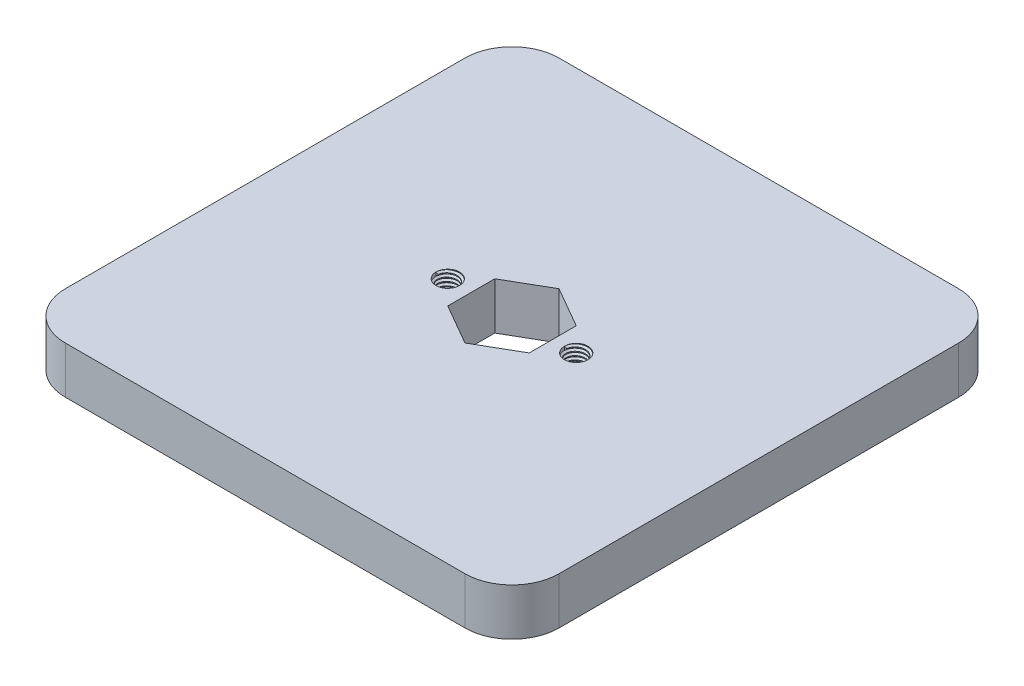
from build123d import *

# Parameters (mm, degrees)
SKETCH1_W           = 105
SKETCH1_H           = 105
SKETCH1_R           = 2.5
BOSS_EXTRUDE1_DEPTH = 10
FILLET1_R           = 10
THREAD1_PITCH       = 0.8
THREAD2_PITCH       = 0.8


with BuildPart() as part:
    # Sketch1 → Boss-Extrude1 (new body)
    with BuildSketch(Plane(origin=(0, 0, 0), x_dir=(1, 0, 0), z_dir=(0, 1, 0))):
        Rectangle(SKETCH1_W, SKETCH1_H)
        with Locations(Location((-13.660254038, 0, 0), (0, 0, 270))):
            Circle(SKETCH1_R, mode=Mode.SUBTRACT)
        with Locations(Location((13.660254038, 0, 0), (0, 0, 270))):
            Circle(SKETCH1_R, mode=Mode.SUBTRACT)
        Polygon((0, 10), (-8.660254038, 5), (-8.660254038, -5), (0, -10), (8.660254038, -5), (8.660254038, 5), align=None, mode=Mode.SUBTRACT)
    extrude(amount=BOSS_EXTRUDE1_DEPTH)

    # Fillet1
    fillet1_edges = [part.edges().sort_by_distance(p)[0] for p in [
        (52.5, 5, 52.5),
        (-52.5, 5, 52.5),
        (-52.5, 5, -52.5),
        (52.5, 5, -52.5),
    ]]
    fillet(fillet1_edges, radius=FILLET1_R)

    # Thread1: the profile of Thread Profile1 profile screwed along a right-hand helix of 12.5 turns, 8 arcs to a turn; built about Z, then put on its axis
    thread1_z = Axis((0, 0, 0), (0, 0, 1))
    thread1_corners = [(2.5003, 0, -0.000173205), (2.5003, 0, 0.700173203), (2.0669873, 0, 0.449999999), (2.0669873, 0, 0.249999999)]
    with BuildLine(mode=Mode.PRIVATE) as thread1_profile:
        Line(thread1_corners[0], thread1_corners[1])
        Line(thread1_corners[1], thread1_corners[2])
        Line(thread1_corners[2], thread1_corners[3])
        Line(thread1_corners[3], thread1_corners[0])
    thread1_cap = Face(thread1_profile.wire())
    thread1_turn_angles = [0, 22.5, 45, 67.5, 90, 112.5, 135, 157.5, 180, 202.5, 225, 247.5, 270, 292.5, 315, 337.5, 360]
    thread1_turn_weights = [1, 0.9238795325112867, 1, 0.9238795325112867, 1, 0.9238795325112867, 1, 0.9238795325112867, 1, 0.9238795325112867, 1, 0.9238795325112867, 1, 0.9238795325112867, 1, 0.9238795325112867, 1]
    thread1_turn_rails = [Edge.make_bspline([Vector(p[0], p[1], 0).rotate(thread1_z, thread1_turn_angles[k]) / thread1_turn_weights[k] + Vector(0, 0, p[2] + THREAD1_PITCH * thread1_turn_angles[k] / 360) for k in range(17)], [0, 0, 0, 1, 1, 2, 2, 3, 3, 4, 4, 5, 5, 6, 6, 7, 7, 8, 8, 8], 2, thread1_turn_weights) for p in thread1_corners]
    thread1_turn_sides = [Face.make_surface_from_curves(thread1_turn_rails[p[0]], thread1_turn_rails[p[1]]) for p in [(0, 1), (1, 2), (2, 3), (3, 0)]]
    thread1_last_angles = [4320, 4342.5, 4365, 4387.5, 4410, 4432.5, 4455, 4477.5, 4500]
    thread1_last_weights = [1, 0.9238795325112867, 1, 0.9238795325112867, 1, 0.9238795325112867, 1, 0.9238795325112867, 1]
    thread1_last_rails = [Edge.make_bspline([Vector(p[0], p[1], 0).rotate(thread1_z, thread1_last_angles[k]) / thread1_last_weights[k] + Vector(0, 0, p[2] + THREAD1_PITCH * thread1_last_angles[k] / 360) for k in range(9)], [0, 0, 0, 1, 1, 2, 2, 3, 3, 4, 4, 4], 2, thread1_last_weights) for p in thread1_corners]
    thread1_last_sides = [Face.make_surface_from_curves(thread1_last_rails[p[0]], thread1_last_rails[p[1]]) for p in [(0, 1), (1, 2), (2, 3), (3, 0)]]
    thread1 = Plane(origin=(-13.660254038, 10, 0), x_dir=(-1, 0, 0), z_dir=(0, -1, 0)) * Solid(Shell([*[p.moved(Location((0, 0, THREAD1_PITCH * i))) for i in range(12) for p in thread1_turn_sides], *thread1_last_sides, thread1_cap, thread1_cap.rotate(thread1_z, 4500).moved(Location((0, 0, THREAD1_PITCH * 4500 / 360)))]))
    add(thread1)

    # Thread2: the profile of Thread Profile2 profile screwed along a right-hand helix of 12.5 turns, 8 arcs to a turn; built about Z, then put on its axis
    thread2_z = Axis((0, 0, 0), (0, 0, 1))
    thread2_corners = [(2.5003, 0, -0.000173205), (2.5003, 0, 0.700173203), (2.0669873, 0, 0.449999999), (2.0669873, 0, 0.249999999)]
    with BuildLine(mode=Mode.PRIVATE) as thread2_profile:
        Line(thread2_corners[0], thread2_corners[1])
        Line(thread2_corners[1], thread2_corners[2])
        Line(thread2_corners[2], thread2_corners[3])
        Line(thread2_corners[3], thread2_corners[0])
    thread2_cap = Face(thread2_profile.wire())
    thread2_turn_angles = [0, 22.5, 45, 67.5, 90, 112.5, 135, 157.5, 180, 202.5, 225, 247.5, 270, 292.5, 315, 337.5, 360]
    thread2_turn_weights = [1, 0.9238795325112867, 1, 0.9238795325112867, 1, 0.9238795325112867, 1, 0.9238795325112867, 1, 0.9238795325112867, 1, 0.9238795325112867, 1, 0.9238795325112867, 1, 0.9238795325112867, 1]
    thread2_turn_rails = [Edge.make_bspline([Vector(p[0], p[1], 0).rotate(thread2_z, thread2_turn_angles[k]) / thread2_turn_weights[k] + Vector(0, 0, p[2] + THREAD2_PITCH * thread2_turn_angles[k] / 360) for k in range(17)], [0, 0, 0, 1, 1, 2, 2, 3, 3, 4, 4, 5, 5, 6, 6, 7, 7, 8, 8, 8], 2, thread2_turn_weights) for p in thread2_corners]
    thread2_turn_sides = [Face.make_surface_from_curves(thread2_turn_rails[p[0]], thread2_turn_rails[p[1]]) for p in [(0, 1), (1, 2), (2, 3), (3, 0)]]
    thread2_last_angles = [4320, 4342.5, 4365, 4387.5, 4410, 4432.5, 4455, 4477.5, 4500]
    thread2_last_weights = [1, 0.9238795325112867, 1, 0.9238795325112867, 1, 0.9238795325112867, 1, 0.9238795325112867, 1]
    thread2_last_rails = [Edge.make_bspline([Vector(p[0], p[1], 0).rotate(thread2_z, thread2_last_angles[k]) / thread2_last_weights[k] + Vector(0, 0, p[2] + THREAD2_PITCH * thread2_last_angles[k] / 360) for k in range(9)], [0, 0, 0, 1, 1, 2, 2, 3, 3, 4, 4, 4], 2, thread2_last_weights) for p in thread2_corners]
    thread2_last_sides = [Face.make_surface_from_curves(thread2_last_rails[p[0]], thread2_last_rails[p[1]]) for p in [(0, 1), (1, 2), (2, 3), (3, 0)]]
    thread2 = Plane(origin=(13.660254038, 10, 0), x_dir=(-1, 0, 0), z_dir=(0, -1, 0)) * Solid(Shell([*[p.moved(Location((0, 0, THREAD2_PITCH * i))) for i in range(12) for p in thread2_turn_sides], *thread2_last_sides, thread2_cap, thread2_cap.rotate(thread2_z, 4500).moved(Location((0, 0, THREAD2_PITCH * 4500 / 360)))]))
    add(thread2)


solid = part.part
